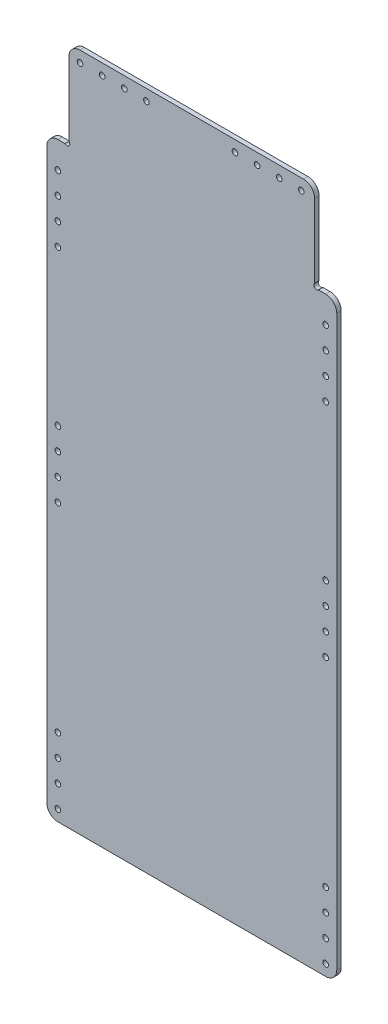
from build123d import *

# Parameters (mm, degrees)
SKETCH1_R           = 2.55
BOSS_EXTRUDE1_DEPTH = 4
FILLET1_R           = 10


with BuildPart() as part:
    # Sketch1 → Boss-Extrude1 (new body)
    with BuildSketch(Plane.XY):
        with BuildLine():
            Line((114.535533906, 534), (131, 534))
            Line((131, 534), (131, 0))
            Line((131, 0), (-131, 0))
            Line((-131, 0), (-131, 534))
            Line((-131, 534), (-114.535533906, 534))
            ThreePointArc((-114.535533906, 534), (-111, 534), (-111, 537.535533906))
            Line((-111, 537.535533906), (-111, 614))
            Line((-111, 614), (111, 614))
            Line((111, 614), (111, 537.535533906))
            ThreePointArc((111, 537.535533906), (111, 534), (114.535533906, 534))
        make_face()
        with Locations((-121, 10)):
            Circle(SKETCH1_R, mode=Mode.SUBTRACT)
        with Locations((-121, 30)):
            Circle(SKETCH1_R, mode=Mode.SUBTRACT)
        with Locations((-121, 50)):
            Circle(SKETCH1_R, mode=Mode.SUBTRACT)
        with Locations((-121, 70)):
            Circle(SKETCH1_R, mode=Mode.SUBTRACT)
        with Locations((-121, 250)):
            Circle(SKETCH1_R, mode=Mode.SUBTRACT)
        with Locations((-121, 270)):
            Circle(SKETCH1_R, mode=Mode.SUBTRACT)
        with Locations((-121, 290)):
            Circle(SKETCH1_R, mode=Mode.SUBTRACT)
        with Locations((-121, 310)):
            Circle(SKETCH1_R, mode=Mode.SUBTRACT)
        with Locations((-121, 450)):
            Circle(SKETCH1_R, mode=Mode.SUBTRACT)
        with Locations((-121, 470)):
            Circle(SKETCH1_R, mode=Mode.SUBTRACT)
        with Locations((-121, 490)):
            Circle(SKETCH1_R, mode=Mode.SUBTRACT)
        with Locations((-121, 510)):
            Circle(SKETCH1_R, mode=Mode.SUBTRACT)
        with Locations((-101, 604)):
            Circle(SKETCH1_R, mode=Mode.SUBTRACT)
        with Locations((-81, 604)):
            Circle(SKETCH1_R, mode=Mode.SUBTRACT)
        with Locations((-61, 604)):
            Circle(SKETCH1_R, mode=Mode.SUBTRACT)
        with Locations((-41, 604)):
            Circle(SKETCH1_R, mode=Mode.SUBTRACT)
        with Locations((39, 604)):
            Circle(SKETCH1_R, mode=Mode.SUBTRACT)
        with Locations((59, 604)):
            Circle(SKETCH1_R, mode=Mode.SUBTRACT)
        with Locations((79, 604)):
            Circle(SKETCH1_R, mode=Mode.SUBTRACT)
        with Locations((99, 604)):
            Circle(SKETCH1_R, mode=Mode.SUBTRACT)
        with Locations((121, 10)):
            Circle(SKETCH1_R, mode=Mode.SUBTRACT)
        with Locations((121, 510)):
            Circle(SKETCH1_R, mode=Mode.SUBTRACT)
        with Locations((121, 490)):
            Circle(SKETCH1_R, mode=Mode.SUBTRACT)
        with Locations((121, 470)):
            Circle(SKETCH1_R, mode=Mode.SUBTRACT)
        with Locations((121, 450)):
            Circle(SKETCH1_R, mode=Mode.SUBTRACT)
        with Locations((121, 310)):
            Circle(SKETCH1_R, mode=Mode.SUBTRACT)
        with Locations((121, 290)):
            Circle(SKETCH1_R, mode=Mode.SUBTRACT)
        with Locations((121, 270)):
            Circle(SKETCH1_R, mode=Mode.SUBTRACT)
        with Locations((121, 250)):
            Circle(SKETCH1_R, mode=Mode.SUBTRACT)
        with Locations((121, 70)):
            Circle(SKETCH1_R, mode=Mode.SUBTRACT)
        with Locations((121, 50)):
            Circle(SKETCH1_R, mode=Mode.SUBTRACT)
        with Locations((121, 30)):
            Circle(SKETCH1_R, mode=Mode.SUBTRACT)
    extrude(amount=BOSS_EXTRUDE1_DEPTH)

    # Fillet1
    fillet1_edges = [part.edges().sort_by_distance(p)[0] for p in [
        (-131, 0, 2),
        (131, 0, 2),
        (131, 534, 2),
        (111, 614, 2),
        (-111, 614, 2),
        (-131, 534, 2),
    ]]
    fillet(fillet1_edges, radius=FILLET1_R)


solid = part.part
